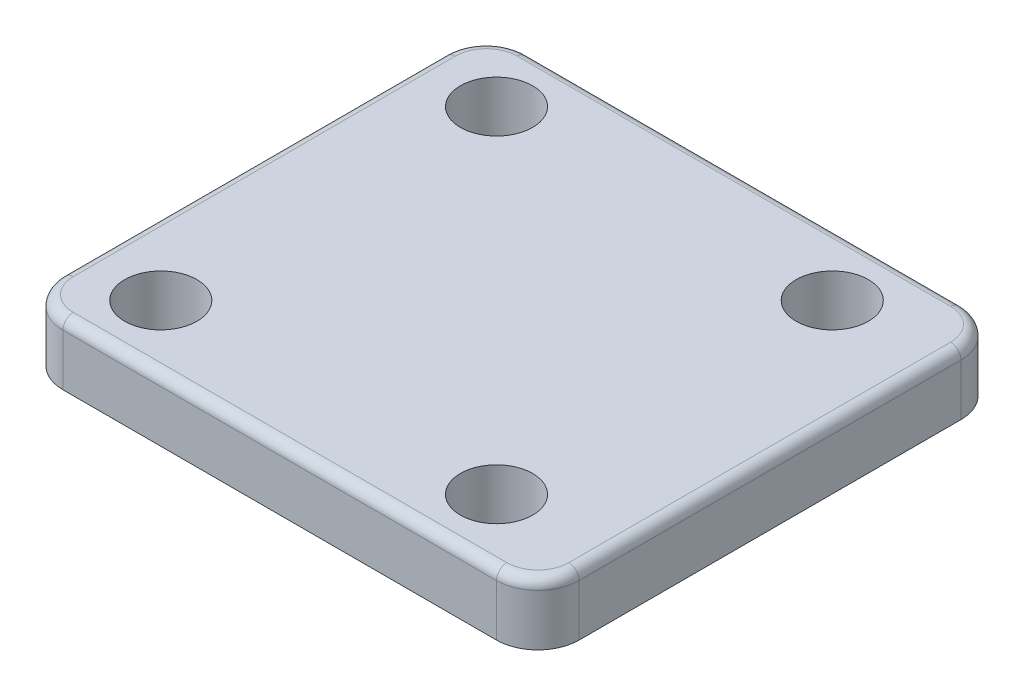
from build123d import *

# Parameters (mm, degrees)
BOSS_EXTRUDE1_DEPTH = 6
FILLET1_R           = 1
SKETCH2_R           = 16
BOSS_EXTRUDE2_DEPTH = 0.5
SKETCH3_R           = 15
BOSS_EXTRUDE3_DEPTH = 0.5
FILLET2_SIZE        = 1
SKETCH5_R           = 3.5
CUT_EXTRUDE2_DEPTH  = 10
CIRPATTERN2_COUNT   = 4


with BuildPart() as part:
    # Sketch1 → Boss-Extrude1 (new body)
    with BuildSketch(Plane(origin=(0, 0, 0), x_dir=(1, 0, 0), z_dir=(0, 1, 0))):
        with BuildLine():
            Line((-21, -22.5), (21, -22.5))
            ThreePointArc((21, -22.5), (23.828427125, -21.328427125), (25, -18.5))
            Line((25, -18.5), (25, 18.5))
            ThreePointArc((25, 18.5), (23.828427125, 21.328427125), (21, 22.5))
            Line((21, 22.5), (-21, 22.5))
            ThreePointArc((-21, 22.5), (-23.828427125, 21.328427125), (-25, 18.5))
            Line((-25, 18.5), (-25, -18.5))
            ThreePointArc((-25, -18.5), (-23.828427125, -21.328427125), (-21, -22.5))
        make_face()
    extrude(amount=BOSS_EXTRUDE1_DEPTH)

    # Fillet1
    fillet1_edges = [part.edges().sort_by_distance(p)[0] for p in [
        (23.828427125, 6, -21.328427125),
        (0, 6, -22.5),
        (-23.828427125, 6, -21.328427125),
        (-25, 6, 0),
        (-23.828427125, 6, 21.328427125),
        (0, 6, 22.5),
        (23.828427125, 6, 21.328427125),
        (25, 6, 0),
    ]]
    fillet(fillet1_edges, radius=FILLET1_R)

    # Sketch2 → Boss-Extrude2 (add)
    with BuildSketch(Plane.XZ):
        with Locations(Location((-1.5, 0, 0), (0, 0, 270))):
            Circle(SKETCH2_R)
    extrude(amount=BOSS_EXTRUDE2_DEPTH)

    # Sketch3 → Boss-Extrude3 (add)
    with BuildSketch(Plane(origin=(0, -0.5, 0), x_dir=(-1, 0, 0), z_dir=(0, -1, 0))):
        with Locations(Location((1.5, 0, 0), (0, 0, 90))):
            Circle(SKETCH3_R)
    extrude(amount=BOSS_EXTRUDE3_DEPTH)

    # Fillet2
    # the kernel refuses this chamfer: 1 mm, written as the material it adds along each edge
    with BuildSketch(Plane(origin=(-1.5, -0.5, 0), x_dir=(0, 0, -1), z_dir=(-1, 0, 0))) as fillet2_piece_1_section:
        Polygon((15 + FILLET2_SIZE, 0), (15, FILLET2_SIZE), (15, 0), align=None)
    fillet2_piece_1 = revolve(axis=Axis((-1.5, -0.5, 0), (0, -1, 0)), mode=Mode.PRIVATE)
    fillet2_piece_1 = fillet2_piece_1 & Plane(origin=(-1.5, -0.725925615, 0), x_dir=(0, 0, -1), z_dir=(0, 1, 0)) * Cylinder(16, 64, mode=Mode.PRIVATE)
    fillet2_piece_1 = split(fillet2_piece_1, bisect_by=Plane(origin=(-1.5, -1, 15.725925615), z_dir=(0, 1, 0)), keep=Keep.TOP, mode=Mode.PRIVATE)
    add(fillet2_piece_1)

    # Sketch5 → Cut-Extrude2 (cut)
    with BuildSketch(Plane(origin=(0, 0, 0), x_dir=(-1, 0, 0), z_dir=(0, -1, 0))):
        with Locations(Location((17.763455967, 16.263455967, 0), (0, 0, 90))):
            Circle(SKETCH5_R)
    cut_extrude2 = extrude(amount=-CUT_EXTRUDE2_DEPTH, mode=Mode.SUBTRACT)

    # CirPattern2: Cut-Extrude2 ×4 about axis
    cirpattern2_axis = Axis((-1.5, 0, 0), (0, 1, 0))
    for i in range(1, CIRPATTERN2_COUNT):
        add(cut_extrude2.rotate(cirpattern2_axis, i * 360 / CIRPATTERN2_COUNT), mode=Mode.SUBTRACT)


solid = part.part
